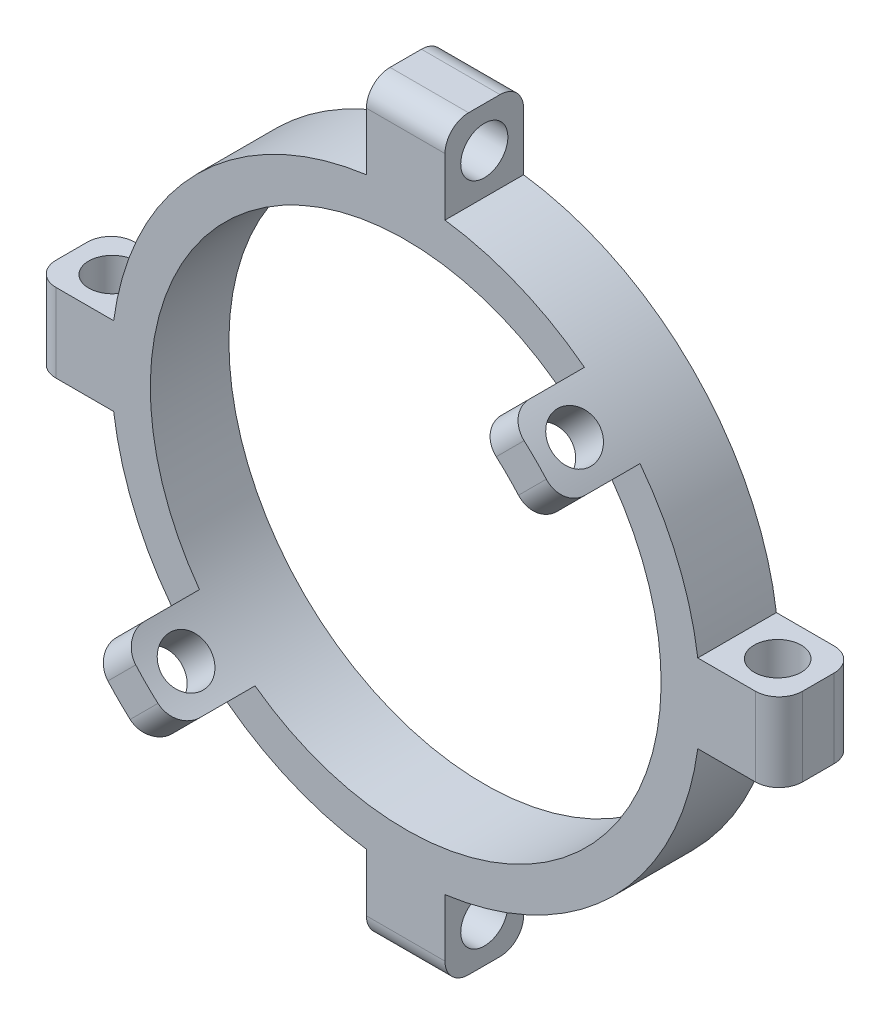
from build123d import *
from build123d.topology import SkipClean

# Parameters (mm, degrees)
CROQUIS1_R                 = 32.5
SALIENTE_EXTRUIR1_DEPTH    = 10
CROQUIS2_R                 = 3
CORTAR_EXTRUIR1_DEPTH      = 72.50174823
MATRIZC1_COUNT             = 4
SALIENTE_EXTRUIR2_DEPTH    = 10
CORTAR_EXTRUIR2_DEPTH      = 71.089228844
CORTAR_EXTRUIR2_DEPTH_BACK = 71.089228844
CROQUIS4_R                 = 3
REDONDEO1_R                = 3
SIMETR_A3_START            = 32.113081288
SIMETR_A3_DEPTH            = 5.333547499
SIMETR_A3_START_2          = -5
SIMETR_A3_2_DEPTH          = 10
SIMETR_A3_3_DEPTH          = 10


# Read off the part's stored shape, not the designer's step: Simetría3
with BuildPart() as part:
    # Croquis1 → Saliente-Extruir1 (new body)
    with BuildSketch(Plane.XY):
        with BuildLine():
            Line((-5, 47.5), (5, 47.5))
            Line((5, 47.5), (5, 37.165171868))
            ThreePointArc((5, 37.165171868), (26.516504294, 26.516504294), (37.165171868, 5))
            Line((37.165171868, 5), (47.5, 5))
            Line((47.5, 5), (47.5, -5))
            Line((47.5, -5), (37.165171868, -5))
            ThreePointArc((37.165171868, -5), (26.516504294, -26.516504294), (5, -37.165171868))
            Line((5, -37.165171868), (5, -47.5))
            Line((5, -47.5), (-5, -47.5))
            Line((-5, -47.5), (-5, -37.165171868))
            ThreePointArc((-5, -37.165171868), (-26.516504294, -26.516504294), (-37.165171868, -5))
            Line((-37.165171868, -5), (-47.5, -5))
            Line((-47.5, -5), (-47.5, 5))
            Line((-47.5, 5), (-37.165171868, 5))
            ThreePointArc((-37.165171868, 5), (-26.516504294, 26.516504294), (-5, 37.165171868))
            Line((-5, 37.165171868), (-5, 47.5))
        make_face()
        Circle(CROQUIS1_R, mode=Mode.SUBTRACT)
    extrude(amount=SALIENTE_EXTRUIR1_DEPTH)

    # Croquis2 → Cortar-Extruir1 (cut, through all)
    with BuildSketch(Plane(origin=(5, 0, 0), x_dir=(0, 0, -1), z_dir=(1, 0, 0))):
        with Locations(Location((-5, -42.332585934, 0), (0, 0, 90))):
            Circle(CROQUIS2_R)
    cortar_extruir1 = extrude(amount=-CORTAR_EXTRUIR1_DEPTH, mode=Mode.SUBTRACT)

    # MatrizC1: Cortar-Extruir1 ×4 about axis
    matrizc1_axis = Axis((0, 0, 10), (0, 0, 1))
    for i in range(1, MATRIZC1_COUNT):
        add(cortar_extruir1.rotate(matrizc1_axis, i * 360 / MATRIZC1_COUNT), mode=Mode.SUBTRACT)

    # Croquis3 → Saliente-Extruir2 (add)
    with SkipClean():  # the faces are left unmerged after this step: merging them gives an invalid solid
        with BuildSketch(Plane.XY.offset(10)):
            with BuildLine():
                Line((19.17184375, 26.242911562), (22.744211146, 29.815278958))
                ThreePointArc((22.744211146, 29.815278958), (26.516504294, 26.516504294), (29.815278958, 22.744211146))
                Line((29.815278958, 22.744211146), (26.242911562, 19.17184375))
                ThreePointArc((26.242911562, 19.17184375), (22.980970389, 22.980970389), (19.17184375, 26.242911562))
            make_face()
            with BuildLine():
                Line((-26.242911562, -19.17184375), (-29.815278958, -22.744211146))
                ThreePointArc((-29.815278958, -22.744211146), (-26.516504294, -26.516504294), (-22.744211146, -29.815278958))
                Line((-22.744211146, -29.815278958), (-19.17184375, -26.242911562))
                ThreePointArc((-19.17184375, -26.242911562), (-22.980970389, -22.980970389), (-26.242911562, -19.17184375))
            make_face()
        extrude(amount=SALIENTE_EXTRUIR2_DEPTH)

    # Croquis4 → Cortar-Extruir2 (cut, two sides: drawn at the far end of the back side and taken through both)
    with SkipClean():  # the faces are left unmerged after this step: merging them gives an invalid solid
        with BuildSketch(Plane(origin=(0, 0, 0), x_dir=(-0.7071067811865476, 0.7071067811865475, 0), z_dir=(-0.7071067811865475, -0.7071067811865476, 0)).offset(-CORTAR_EXTRUIR2_DEPTH_BACK)):
            with Locations(Location((0, -15, 0), (0, 0, 180))):
                Circle(CROQUIS4_R)
        extrude(amount=CORTAR_EXTRUIR2_DEPTH + CORTAR_EXTRUIR2_DEPTH_BACK, mode=Mode.SUBTRACT)

    # Redondeo1
    redondeo1_edges = [part.edges().sort_by_distance(p)[0] for p in [
        (-47.5, 0, 10),
        (0, -47.5, 0),
        (-47.5, 0, 0),
        (0, -47.5, 10),
        (-28.02909526, -20.958027448, 20),
        (-20.958027448, -28.02909526, 20),
    ]]
    fillet(redondeo1_edges, radius=REDONDEO1_R)

    # Simetría3 outline → Simetría3 (cut)
    with SkipClean():  # the faces are left unmerged after this step: merging them gives an invalid solid
        with BuildSketch(Plane(origin=(0, 0, 0), x_dir=(0.707106781186546, -0.707106781186549, 0), z_dir=(0.707106781186549, 0.707106781186546, 0)).offset(SIMETR_A3_START)):
            with BuildLine():
                Line((-5, -20), (-2, -20))
                ThreePointArc((-2, -20), (-4.121320344, -19.121320344), (-5, -17))
                Line((-5, -17), (-5, -20))
            make_face()
            with BuildLine():
                ThreePointArc((5, -17), (4.121320344, -19.121320344), (2, -20))
                Line((2, -20), (5, -20))
                Line((5, -20), (5, -17))
            make_face()
        extrude(amount=SIMETR_A3_DEPTH, mode=Mode.SUBTRACT)

    # Simetr_a3 2 outline → Simetr_a3 2 (cut)
    with SkipClean():  # the faces are left unmerged after this step: merging them gives an invalid solid
        with BuildSketch(Plane.YZ.offset(SIMETR_A3_START_2)):
            with BuildLine():
                Line((47.5, 10), (44.5, 10))
                ThreePointArc((44.5, 10), (46.621320344, 9.121320344), (47.5, 7))
                Line((47.5, 7), (47.5, 10))
            make_face()
            with BuildLine():
                Line((47.5, 0), (47.5, 3))
                ThreePointArc((47.5, 3), (46.621320344, 0.878679656), (44.5, 0))
                Line((44.5, 0), (47.5, 0))
            make_face()
        extrude(amount=SIMETR_A3_2_DEPTH, mode=Mode.SUBTRACT)

    # Simetr_a3 3 outline → Simetr_a3 3 (cut)
    with SkipClean():  # the faces are left unmerged after this step: merging them gives an invalid solid
        with BuildSketch(Plane(origin=(0, 0, 0), x_dir=(1, 0, 0), z_dir=(0, 1, 0)).offset(SIMETR_A3_START_2)):
            with BuildLine():
                Line((47.5, 0), (44.5, 0))
                ThreePointArc((44.5, 0), (46.621320344, -0.878679656), (47.5, -3))
                Line((47.5, -3), (47.5, 0))
            make_face()
            with BuildLine():
                Line((47.5, -10), (47.5, -7))
                ThreePointArc((47.5, -7), (46.621320344, -9.121320344), (44.5, -10))
                Line((44.5, -10), (47.5, -10))
            make_face()
        extrude(amount=SIMETR_A3_3_DEPTH, mode=Mode.SUBTRACT)


solid = part.part
